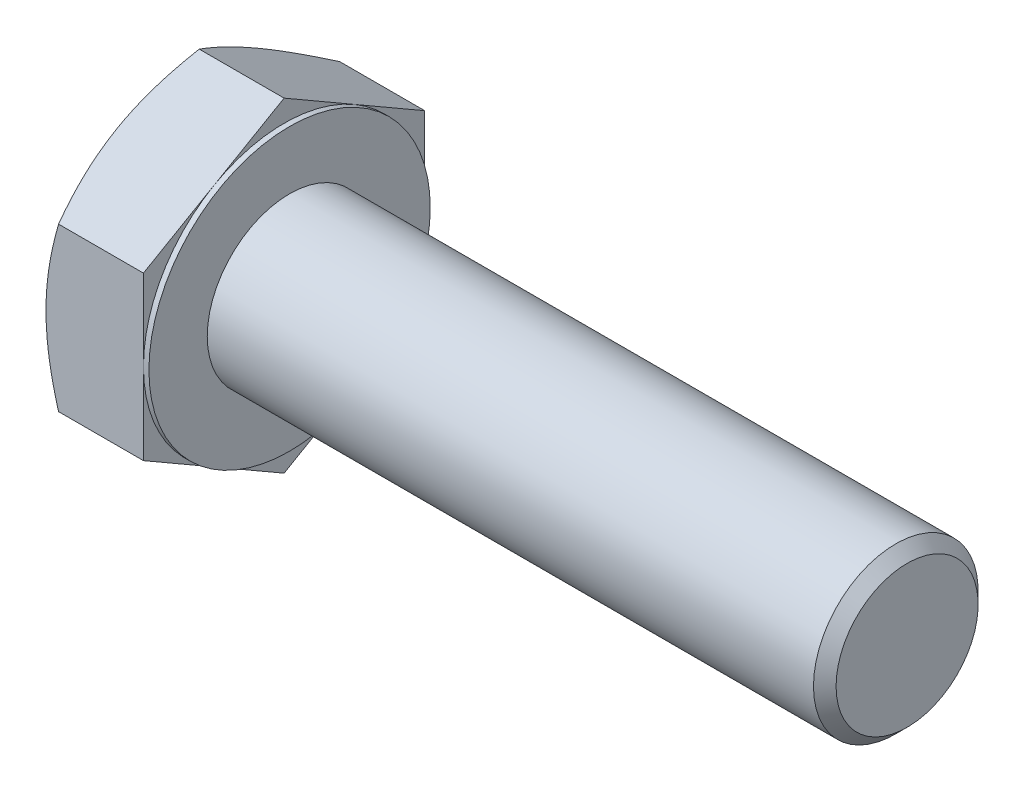
from build123d import *

# Parameters (mm, degrees)
BASEHEAD_DEPTH = 15
SKETCH4_W      = 0.8
SKETCH4_H      = 13.171361037


# Read off the part's stored shape, not the designer's step: HeadChamfer
with BuildPart() as part:
    # Sketch1 → BaseHead (new body)
    with BuildSketch(Plane(origin=(0, 0, 0), x_dir=(0, 0, -1), z_dir=(1, 0, 0))):
        Polygon((20.5, 11.835680518), (20.5, -11.835680518), (0, -23.671361037), (-20.5, -11.835680518), (-20.5, 11.835680518), (0, 23.671361037), align=None)
    extrude(amount=BASEHEAD_DEPTH)

    # HeadChamfer outline → HeadChamfer (revolve, cut)
    with BuildSketch(Plane.YX):
        Polygon((23.671361268, 1.830986282), (20.499999702, -1.72e-07), (23.671361268, -1.72e-07), align=None)
    revolve(axis=Axis((0, 0, 0), (1, 0, 0)), mode=Mode.SUBTRACT)

    # HeadChamfer 2 outline → HeadChamfer 2 (revolve)
    with BuildSketch(Plane.YX):
        Polygon((12, 15), (12, 103.352), (10.352, 105), (0, 105), (0, 15), align=None)
    revolve(axis=Axis((0, 0, 0), (1, 0, 0)))

    # Sketch4 → BearingFace (revolve, cut)
    with BuildSketch(Plane.XY, mode=Mode.PRIVATE) as bearingface_sk:
        with Locations((14.6, 27.085680519)):
            Rectangle(SKETCH4_W, SKETCH4_H)
    revolve(bearingface_sk.sketch.rotate(Axis((0, 0, 0), (1, 0, 0)), 90), axis=Axis((0, 0, 0), (1, 0, 0)), mode=Mode.SUBTRACT)


solid = part.part
